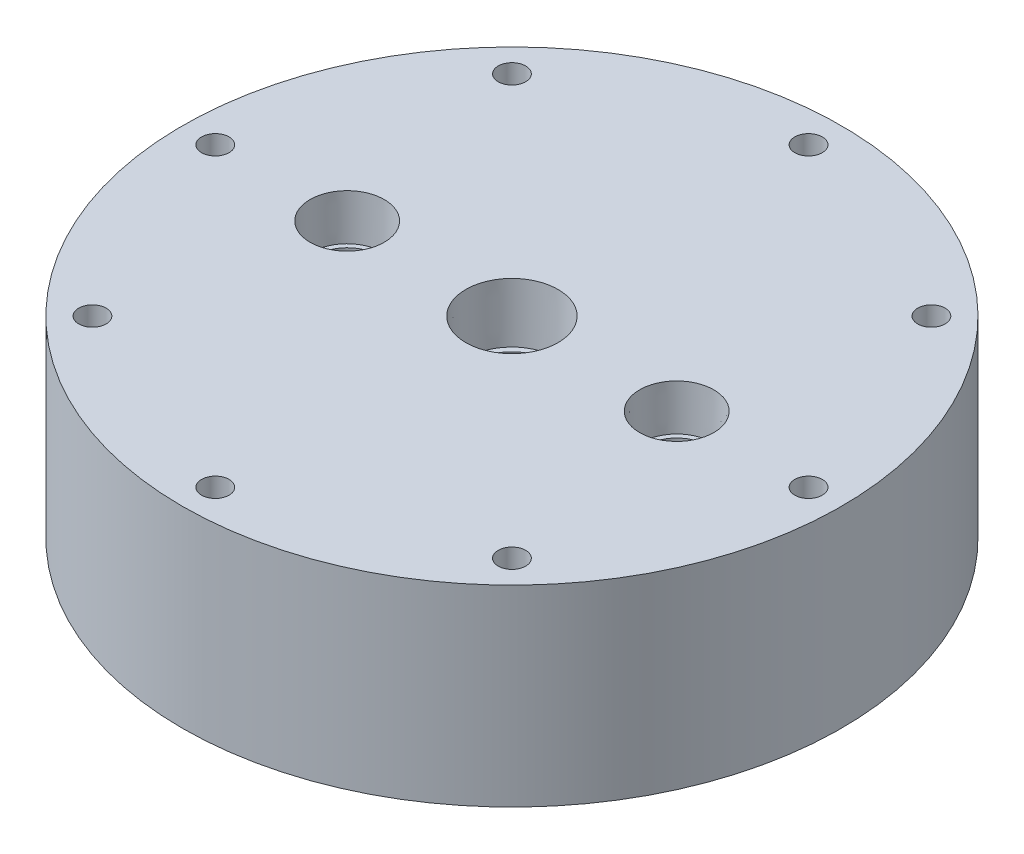
from build123d import *

# Parameters (mm, degrees)
F_3_8_NPT_TAPPED_HOLE1_AT_2_COUNT = 2
F_3_8_NPT_TAPPED_HOLE1_AT_2_PITCH = 76.2
BOLT_HOLES_PROFILE_R              = 3.175
BOLT_HOLES_DEPTH                  = 117.570504417
DOWEL_HOLES_PROFILE_R             = 1.27
DOWEL_HOLES_DEPTH                 = 2.54


with BuildPart() as part:
    # Main Shape Profile → Main Shape (revolve)
    with BuildSketch(Plane.XY):
        Polygon((0, 44.45), (0, 22.86), (22.225, 22.86), (22.225, 12.7), (25.4, 12.7), (25.4, 14.732), (27.432, 14.732), (27.432, 12.7), (28.575, 12.7), (28.575, 6.35), (57.15, 6.35), (57.15, 0), (76.2, 0), (76.2, 44.45), align=None)
    revolve(axis=Axis((0, 0, 0), (0, -1, 0)))

    # Sketch3 → 1/2 NPT Tapped Hole1 (revolve, cut)
    with BuildSketch(Plane(origin=(0, 44.45, 0), x_dir=(0, 0, 1), z_dir=(1, 0, 0))):
        Polygon((0, 0), (0, 44.45), (8.9281, 44.45), (8.9281, 13.462), (10.261665792, 13.462), (10.6647361, 0), align=None)
    revolve(axis=Axis((0, 50.8, 0), (0, -1, 0)), mode=Mode.SUBTRACT)

    # Sketch4 → 3/8 NPT Tapped Hole1 (revolve, cut)
    with BuildSketch(Plane(origin=(-38.1, 44.45, 0), x_dir=(0, 0, 1), z_dir=(1, 0, 0))):
        Polygon((0, 0), (0, 44.45), (7.1374, 44.45), (7.1374, 10.414), (8.263205494, 10.414), (8.5750146, 0), align=None)
    f_3_8_npt_tapped_hole1 = revolve(axis=Axis((-38.1, 50.8, 0), (0, -1, 0)), mode=Mode.SUBTRACT)

    # 3/8 NPT Tapped Hole1 at 2: 3/8 NPT Tapped Hole1 ×2
    with Locations(*[(i * F_3_8_NPT_TAPPED_HOLE1_AT_2_PITCH, 0, 0) for i in range(1, F_3_8_NPT_TAPPED_HOLE1_AT_2_COUNT)]):
        add(f_3_8_npt_tapped_hole1, mode=Mode.SUBTRACT)

    # Bolt Holes Profile → Bolt Holes (cut, through all)
    with BuildSketch(Plane(origin=(0, 44.45, 0), x_dir=(1, 0, 0), z_dir=(0, 1, 0))):
        with Locations((0, 68.58)):
            Circle(BOLT_HOLES_PROFILE_R)
        with Locations((48.493383054, 48.493383054)):
            Circle(BOLT_HOLES_PROFILE_R)
        with Locations((68.58, 0)):
            Circle(BOLT_HOLES_PROFILE_R)
        with Locations((48.493383054, -48.493383054)):
            Circle(BOLT_HOLES_PROFILE_R)
        with Locations((0, -68.58)):
            Circle(BOLT_HOLES_PROFILE_R)
        with Locations((-48.493383054, -48.493383054)):
            Circle(BOLT_HOLES_PROFILE_R)
        with Locations((-68.58, 0)):
            Circle(BOLT_HOLES_PROFILE_R)
        with Locations((-48.493383054, 48.493383054)):
            Circle(BOLT_HOLES_PROFILE_R)
    extrude(amount=-BOLT_HOLES_DEPTH, mode=Mode.SUBTRACT)

    # Dowel Holes Profile → Dowel Holes (cut)
    with BuildSketch(Plane.XZ.offset(-6.35)):
        with Locations((0, 46.355)):
            Circle(DOWEL_HOLES_PROFILE_R)
        with Locations((0, -46.355)):
            Circle(DOWEL_HOLES_PROFILE_R)
    extrude(amount=-DOWEL_HOLES_DEPTH, mode=Mode.SUBTRACT)


solid = part.part
